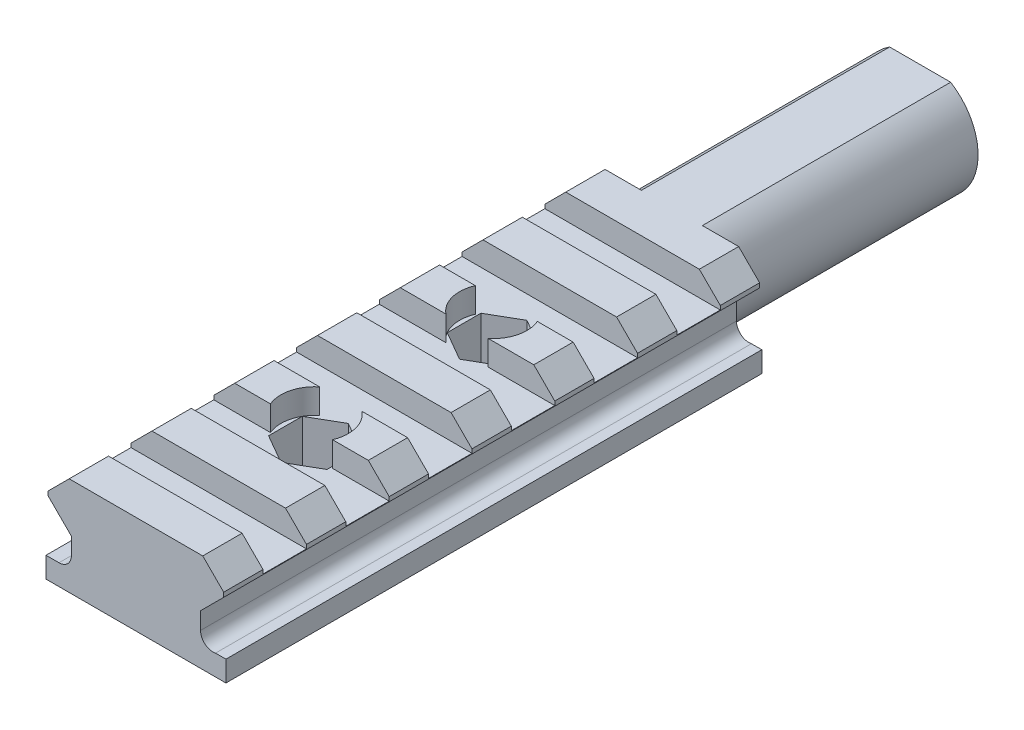
from build123d import *

# Parameters (mm, degrees)
BOSS_EXTRUDE1_DEPTH = 64.75
SKETCH3_W           = 5.25
SKETCH3_H           = 3
CUT_EXTRUDE1_DEPTH  = 60
SKETCH4_R           = 2.025
CUT_EXTRUDE2_DEPTH  = 9.1
SKETCH4_4_R         = 2.025
CUT_EXTRUDE3_DEPTH  = 59.1
SKETCH4_5_R         = 4.070319398
CUT_EXTRUDE4_DEPTH  = 3
BOSS_EXTRUDE2_DEPTH = 30


with BuildPart() as part:
    # Sketch2 → Boss-Extrude1 (new body)
    with BuildSketch(Plane.XY):
        with BuildLine():
            Line((-10.6, -0.27), (-7.8, -3.07))
            Line((-7.8, -3.07), (-7.8, -5.1))
            ThreePointArc((-7.8, -5.1), (-8.239339828, -6.160660172), (-9.3, -6.6))
            Line((-9.3, -6.6), (-10.87, -6.6))
            Line((-10.87, -6.6), (-10.87, -9.1))
            Line((-10.87, -9.1), (10.87, -9.1))
            Line((10.87, -9.1), (10.87, -6.6))
            Line((10.87, -6.6), (9.613338096, -6.6))
            ThreePointArc((9.613338096, -6.6), (8.35660378, -6.299283857), (7.8, -5.133091946))
            Line((7.8, -5.133091946), (7.8, -3.07))
            Line((7.8, -3.07), (10.6, -0.27))
            Line((10.6, -0.27), (10.6, 0.27))
            Line((10.6, 0.27), (8.07, 2.8))
            Line((8.07, 2.8), (-8.07, 2.8))
            Line((-8.07, 2.8), (-10.6, 0.27))
            Line((-10.6, 0.27), (-10.6, -0.27))
        make_face()
    extrude(amount=BOSS_EXTRUDE1_DEPTH)

    # Sketch3 → Cut-Extrude1 (cut)
    with BuildSketch(Plane.ZY.offset(10.87)):
        with Locations((17.375, 1.3)):
            Rectangle(SKETCH3_W, SKETCH3_H)
        with Locations((7.375, 1.3)):
            Rectangle(SKETCH3_W, SKETCH3_H)
        with Locations((27.375, 1.3)):
            Rectangle(SKETCH3_W, SKETCH3_H)
        with Locations((37.375, 1.3)):
            Rectangle(SKETCH3_W, SKETCH3_H)
        with Locations((47.375, 1.3)):
            Rectangle(SKETCH3_W, SKETCH3_H)
        with Locations((57.375, 1.3)):
            Rectangle(SKETCH3_W, SKETCH3_H)
    extrude(amount=-CUT_EXTRUDE1_DEPTH, mode=Mode.SUBTRACT)

    # Sketch4 → Cut-Extrude2 (cut)
    # profile 1 of 2: a face of its own
    with BuildSketch(Plane(origin=(0, 2.8, 0), x_dir=(1, 0, 0), z_dir=(0, 1, 0))):
        Polygon((3.525, -19.548173634), (0, -17.513013936), (-3.525, -19.548173634), (-3.525, -23.618493032), (0, -25.653652731), (3.525, -23.618493032), align=None)
        with Locations((0, -21.583333333)):
            Circle(SKETCH4_R, mode=Mode.SUBTRACT)
    # profile 2 of 2: a face of its own
    with BuildSketch(Plane(origin=(0, 2.8, 0), x_dir=(1, 0, 0), z_dir=(0, 1, 0))):
        Polygon((-3.525, -45.201826366), (0, -47.236986064), (3.525, -45.201826366), (3.525, -41.131506968), (0, -39.096347269), (-3.525, -41.131506968), align=None)
        with Locations((0, -43.166666667)):
            Circle(SKETCH4_R, mode=Mode.SUBTRACT)
    extrude(amount=-CUT_EXTRUDE2_DEPTH, mode=Mode.SUBTRACT)

    # Sketch4<4> → Cut-Extrude3 (cut)
    with BuildSketch(Plane(origin=(0, 2.8, 0), x_dir=(1, 0, 0), z_dir=(0, 1, 0))):
        with Locations((0, -21.583333333)):
            Circle(SKETCH4_4_R)
        with Locations((0, -43.166666667)):
            Circle(SKETCH4_4_R)
    extrude(amount=-CUT_EXTRUDE3_DEPTH, mode=Mode.SUBTRACT)

    # Sketch4<5> → Cut-Extrude4 (cut)
    with BuildSketch(Plane(origin=(0, 2.8, 0), x_dir=(1, 0, 0), z_dir=(0, 1, 0))):
        with Locations((0, -21.583333333)):
            Circle(SKETCH4_5_R)
        with Locations((0, -43.166666667)):
            Circle(SKETCH4_5_R)
    extrude(amount=-CUT_EXTRUDE4_DEPTH, mode=Mode.SUBTRACT)

    # Sketch5 → Boss-Extrude2 (add)
    with BuildSketch(Plane(origin=(0, 0, 0), x_dir=(-1, 0, 0), z_dir=(0, 0, -1))):
        with BuildLine():
            ThreePointArc((-3.687478813, 2.8), (-7, -3.15), (-3.687478813, -9.1))
            Line((-3.687478813, -9.1), (3.687478813, -9.1))
            ThreePointArc((3.687478813, -9.1), (7, -3.15), (3.687478813, 2.8))
            Line((3.687478813, 2.8), (-3.687478813, 2.8))
        make_face()
    extrude(amount=BOSS_EXTRUDE2_DEPTH)


solid = part.part
